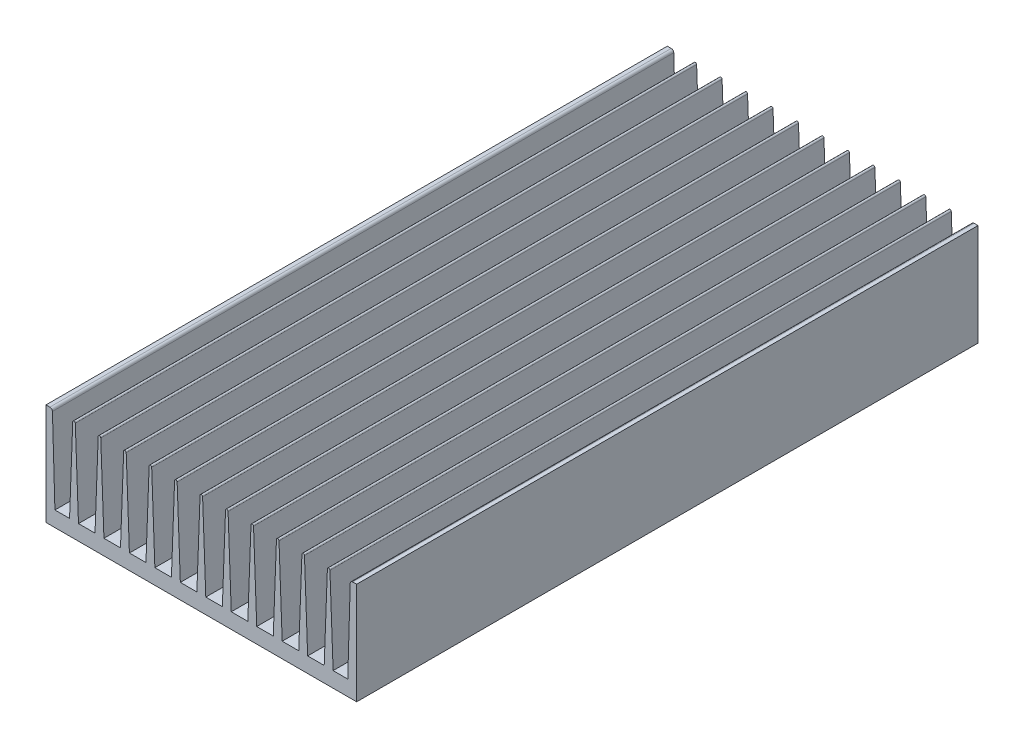
from build123d import *

# Parameters (mm, degrees)
EXTRUDE_1_DEPTH       = 244
EXTRUDE_3_DEPTH       = 244
PATTERN_CURVE_1_COUNT = 11
PATTERN_CURVE_1_PITCH = 10
SKETCH_3_R            = 2.25
CUT_EXTRUDE_1_DEPTH   = 6
SKETCH_4_R            = 1.6
SKETCH_4_R_2          = 1.15
CUT_EXTRUDE_2_DEPTH   = 6


with BuildPart() as part:
    # Эскиз1 → Вытянуть1 (new body)
    with BuildSketch(Plane.XY):
        with BuildLine():
            Line((0, 40), (1.528979332, 40))
            ThreePointArc((1.528979332, 40), (2.225614441, 39.717425624), (2.528547087, 39.029399052))
            Line((2.528547087, 39.029399052), (3.5, 6))
            Line((3.5, 6), (118.5, 6))
            Line((118.5, 6), (119.471452913, 39.029399052))
            ThreePointArc((119.471452913, 39.029399052), (119.774385559, 39.717425624), (120.471020668, 40))
            Line((120.471020668, 40), (122, 40))
            Line((122, 40), (122, 0))
            Line((122, 0), (0, 0))
            Line((0, 0), (0, 40))
        make_face()
    extrude(amount=EXTRUDE_1_DEPTH)

    # Эскиз2 → Вытянуть3 (add)
    with BuildSketch(Plane.XY.offset(244)):
        with BuildLine():
            Line((10.5, 39.5), (9.25, 6))
            Line((9.25, 6), (12.75, 6))
            Line((12.75, 6), (11.5, 39.5))
            ThreePointArc((11.5, 39.5), (11, 40), (10.5, 39.5))
        make_face()
    extrude_3 = extrude(amount=-EXTRUDE_3_DEPTH)

    # Кривая1: Вытянуть3 ×11
    with Locations(*[(i * PATTERN_CURVE_1_PITCH, 0, 0) for i in range(1, PATTERN_CURVE_1_COUNT)]):
        add(extrude_3)

    # Эскиз3 → Вырез-Вытянуть1 (cut)
    with BuildSketch(Plane.XZ):
        with Locations((26, 236)):
            Circle(SKETCH_3_R)
        with Locations((96, 236)):
            Circle(SKETCH_3_R)
        with Locations((96, 8)):
            Circle(SKETCH_3_R)
        with Locations((26, 8)):
            Circle(SKETCH_3_R)
    extrude(amount=-CUT_EXTRUDE_1_DEPTH, mode=Mode.SUBTRACT)

    # Эскиз4 → Вырез-Вытянуть2 (cut)
    with BuildSketch(Plane(origin=(133.240090243, 0, 310.149074448), x_dir=(-1, 0, 0), z_dir=(0, -1, 0))):
        with Locations((8.990090243, 225.549074448)):
            Circle(SKETCH_4_R)
        with Locations((83.240090243, 178.149074448)):
            Circle(SKETCH_4_R_2)
        with Locations((69.240090243, 163.149074448)):
            Circle(SKETCH_4_R)
        with Locations((61.240090243, 283.149074448)):
            Circle(SKETCH_4_R)
        with Locations((61.240090243, 178.149074448)):
            Circle(SKETCH_4_R)
        with Locations((107.240090243, 178.149074448)):
            Circle(SKETCH_4_R_2)
    extrude(amount=-CUT_EXTRUDE_2_DEPTH, mode=Mode.SUBTRACT)


solid = part.part
